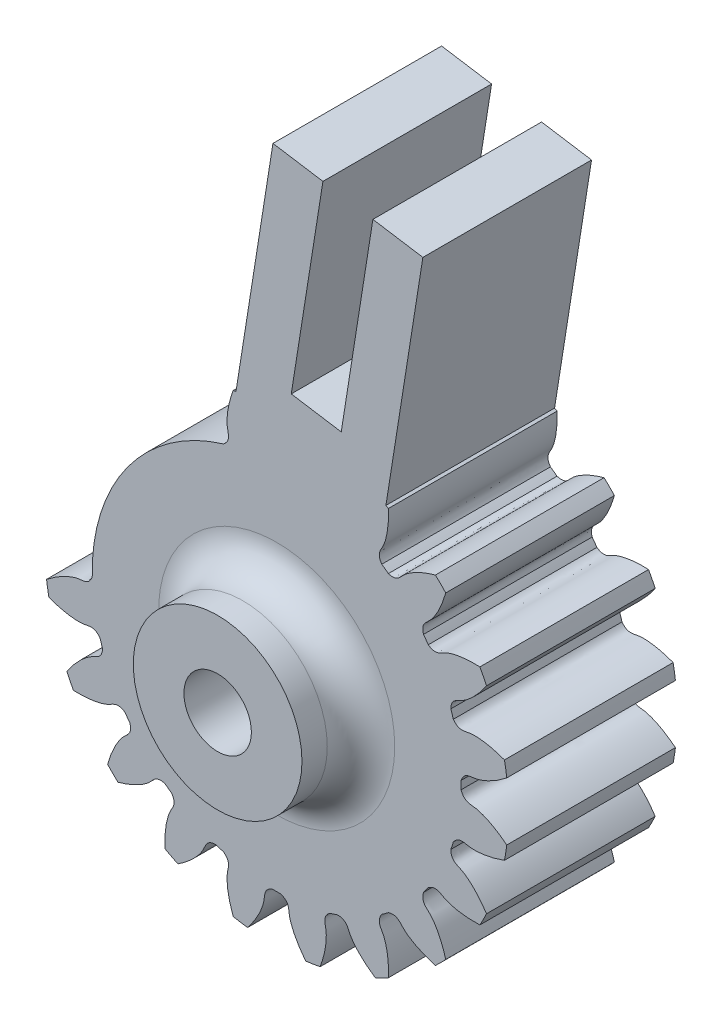
from build123d import *

# Parameters (mm, degrees)
SKETCH_1_R               = 13.75
EXTRUDE_1_DEPTH          = 10
CUT_EXTRUDE_1_DEPTH      = 22.866069606
PATTERN_CIRCULAR_1_COUNT = 20
EXTRUDE_2_DEPTH          = 5
EXTRUDE_2_DEPTH_BACK     = 15
CUT_EXTRUDE_3_DEPTH      = 10
CUT_EXTRUDE_3_DEPTH_BACK = 32
SKETCH_7_W               = 5
SKETCH_7_H               = 32
CUT_EXTRUDE_START        = -22
CUT_EXTRUDE_4_DEPTH      = 22
FILLET_2_R               = 2
FILLET_3_R               = 3
SKETCH_16_R              = 2
CUT_EXTRUDE_5_DEPTH      = 16.5
EXTRUDE_START            = 3.5
SKETCH_18_R              = 5
SKETCH_18_R_2            = 2
EXTRUDE_4_DEPTH          = 3.5
SKETCH_19_R              = 8
CUT_EXTRUDE_7_DEPTH      = 3
FILLET_4_R               = 2
CUT_EXTRUDE_8_DEPTH      = 10
CUT_EXTRUDE_9_DEPTH      = 36
CUT_EXTRUDE_9_DEPTH_BACK = 22


with BuildPart() as part:
    # 草图1 → 凸台-拉伸1 (new body)
    with BuildSketch(Plane.XY):
        Circle(SKETCH_1_R)
    extrude(amount=EXTRUDE_1_DEPTH)

    # 草图2 → 切除-拉伸1 (cut, through all)
    with BuildSketch(Plane.XY):
        with BuildLine():
            ThreePointArc((0.241645751, 10.934830295), (0, 10.9375), (-0.241645751, 10.934830295))
            add(Edge.make_bspline(
                [(-0.241645751, 10.934830295), (-0.763986756, 11.11684439), (-0.696355124, 11.483892124), (-0.766121321, 11.837511753), (-0.773615233, 11.871945767), (-0.782888612, 11.910793269), (-0.794115121, 11.953996045), (-0.807473925, 12.001489371), (-0.823140069, 12.053203535), (-0.841287339, 12.109063416), (-0.862087187, 12.168988684), (-0.885708875, 12.232893806), (-0.912319248, 12.300688126), (-0.942082628, 12.372275913), (-0.975160664, 12.447556439), (-1.011712206, 12.526424039), (-1.051893167, 12.608768189), (-1.095856396, 12.694473577), (-1.143751548, 12.783420187), (-1.195724957, 12.87548338), (-1.251919512, 12.970533976), (-1.312474533, 13.068438347), (-1.377525652, 13.169058507), (-1.447204695, 13.272252205), (-1.521639564, 13.377873025), (-1.600954126, 13.485770488), (-1.685268101, 13.595790151), (-1.774696952, 13.707773716), (-1.869351783, 13.821559139), (-1.969339231, 13.936980743), (-2.074761371, 14.053869328), (-2.185715611, 14.172052294), (-2.302294605, 14.291353753), (-2.424586158, 14.411594659), (-2.552673133, 14.532592924), (-2.686633373, 14.654163553), (-2.826539612, 14.776118764), (-2.972459398, 14.898268124), (-3.124455015, 15.020418683), (-3.282583418, 15.142375102), (-3.446896124, 15.2639398), (-3.676841988, 15.427049835), (-3.854915516, 15.545415751), (-3.976447477, 15.622814825)],
                knots=[0, 0, 0, 0, 0.165916003, 0.170905922, 0.176663519, 0.183188797, 0.190481754, 0.198542391, 0.207370708, 0.216966704, 0.22733038, 0.238461736, 0.250360771, 0.263027487, 0.276461881, 0.290663956, 0.30563371, 0.321371144, 0.337876258, 0.355149051, 0.373189524, 0.391997677, 0.411573509, 0.431917021, 0.453028213, 0.474907084, 0.497553636, 0.520967867, 0.545149777, 0.570099367, 0.595816637, 0.622301587, 0.649554216, 0.677574526, 0.706362514, 0.735918183, 0.766241531, 0.797332559, 0.829191267, 0.861817654, 0.895211721, 0.929373468, 1, 1, 1, 1], degree=3))
            ThreePointArc((-3.976447477, 15.622814825), (0, 16.120932901), (3.976447477, 15.622814825))
            add(Edge.make_bspline(
                [(0.241645751, 10.934830295), (0.763986756, 11.11684439), (0.696355124, 11.483892124), (0.766121321, 11.837511753), (0.773615233, 11.871945767), (0.782888612, 11.910793269), (0.794115121, 11.953996045), (0.807473925, 12.001489371), (0.823140069, 12.053203535), (0.841287339, 12.109063416), (0.862087187, 12.168988684), (0.885708875, 12.232893806), (0.912319248, 12.300688126), (0.942082628, 12.372275913), (0.975160664, 12.447556439), (1.011712206, 12.526424039), (1.051893167, 12.608768189), (1.095856396, 12.694473577), (1.143751548, 12.783420187), (1.195724957, 12.87548338), (1.251919512, 12.970533976), (1.312474533, 13.068438347), (1.377525652, 13.169058507), (1.447204695, 13.272252205), (1.521639564, 13.377873025), (1.600954126, 13.485770488), (1.685268101, 13.595790151), (1.774696952, 13.707773716), (1.869351783, 13.821559139), (1.969339231, 13.936980743), (2.074761371, 14.053869328), (2.185715611, 14.172052294), (2.302294605, 14.291353753), (2.424586158, 14.411594659), (2.552673133, 14.532592924), (2.686633373, 14.654163553), (2.826539612, 14.776118764), (2.972459398, 14.898268124), (3.124455015, 15.020418683), (3.282583418, 15.142375102), (3.446896124, 15.2639398), (3.676841988, 15.427049835), (3.854915516, 15.545415751), (3.976447477, 15.622814825)],
                knots=[0, 0, 0, 0, 0.165916003, 0.170905922, 0.176663519, 0.183188797, 0.190481754, 0.198542391, 0.207370708, 0.216966704, 0.22733038, 0.238461736, 0.250360771, 0.263027487, 0.276461881, 0.290663956, 0.30563371, 0.321371144, 0.337876258, 0.355149051, 0.373189524, 0.391997677, 0.411573509, 0.431917021, 0.453028213, 0.474907084, 0.497553636, 0.520967867, 0.545149777, 0.570099367, 0.595816637, 0.622301587, 0.649554216, 0.677574526, 0.706362514, 0.735918183, 0.766241531, 0.797332559, 0.829191267, 0.861817654, 0.895211721, 0.929373468, 1, 1, 1, 1], degree=3))
        make_face()
    cut_extrude_1 = extrude(amount=CUT_EXTRUDE_1_DEPTH, mode=Mode.SUBTRACT)

    # 阵列(圆周)1: 切除-拉伸1 ×20 about axis
    pattern_circular_1_axis = Axis((0, 0, -1.5), (0, 0, 1))
    for i in range(1, PATTERN_CIRCULAR_1_COUNT):
        add(cut_extrude_1.rotate(pattern_circular_1_axis, i * 360 / PATTERN_CIRCULAR_1_COUNT), mode=Mode.SUBTRACT)

    # 草图6 → 凸台-拉伸2 (add, two sides: drawn at the far end of the back side and taken through both)
    with BuildSketch(Plane(origin=(0, 0, 0), x_dir=(-1, 0, 0), z_dir=(0, 0, -1)).offset(-EXTRUDE_2_DEPTH_BACK)):
        with BuildLine():
            Line((-4.444597533, -0.703955093), (4.444597533, 0.703955093))
            Line((4.444597533, 0.703955093), (-1.123309149, 35.858334335))
            ThreePointArc((-1.123309149, 35.858334335), (6.18175463, 61.653569146), (-11.311209389, 81.969924763))
            Line((-11.311209389, 81.969924763), (-15.719831619, 70.4850712))
            Line((-15.719831619, 70.4850712), (-10.012504214, 34.45042415))
            Line((-10.012504214, 34.45042415), (-4.444597533, -0.703955093))
        make_face()
    extrude(amount=EXTRUDE_2_DEPTH + EXTRUDE_2_DEPTH_BACK)

    # 草图7 → 切除-拉伸3 (cut, two sides: drawn at the far end of the back side and taken through both)
    with BuildSketch(Plane(origin=(4.444597533, -0.703955093, 0), x_dir=(0, 0, -1), z_dir=(0.9876883405951377, -0.15643446504023123, 0)).offset(-CUT_EXTRUDE_3_DEPTH_BACK)):
        with Locations((2.5, 16)):
            Rectangle(SKETCH_7_W, SKETCH_7_H)
        with Locations((-12.5, 16)):
            Rectangle(SKETCH_7_W, SKETCH_7_H)
    extrude(amount=CUT_EXTRUDE_3_DEPTH + CUT_EXTRUDE_3_DEPTH_BACK, mode=Mode.SUBTRACT)

    # 草图13 → 切除-旋转2 (revolve, cut)
    with BuildSketch(Plane(origin=(12.346104257, -1.955430813, 0), x_dir=(0, 0, 1), z_dir=(-0.9876883405951388, 0.1564344650402244, 0))):
        with BuildLine():
            Line((5, 82.653118449), (5, 34.653118449))
            ThreePointArc((5, 34.653118449), (29, 58.653118449), (5, 82.653118449))
        make_face()
    revolve(axis=Axis((12.41385891, -1.527644771, 5), (0.1564344650402244, 0.9876883405951388, 0)), mode=Mode.SUBTRACT)

    # 草图12 → 切除-拉伸4 (cut)
    with BuildSketch(Plane(origin=(0, 0, -5), x_dir=(-1, 0, 0), z_dir=(0, 0, -1)).offset(CUT_EXTRUDE_START)):
        with BuildLine():
            Line((-11.311209389, 81.969924763), (-11.670273789, 81.03453002))
            ThreePointArc((-11.670273789, 81.03453002), (1.044926137, 71.010674644), (5.846281188, 55.547784376))
            ThreePointArc((5.846281188, 55.547784376), (3.991334875, 45.656412233), (-1.321428913, 37.109213298))
            Line((-1.321428913, 37.109213298), (-1.123309149, 35.858334335))
            ThreePointArc((-1.123309149, 35.858334335), (4.779753161, 44.926816989), (6.848224584, 55.547784376))
            ThreePointArc((6.848224584, 55.547784376), (1.87065393, 71.578181633), (-11.311209389, 81.969924763))
        make_face()
    extrude(amount=CUT_EXTRUDE_4_DEPTH, mode=Mode.SUBTRACT)

    # 圆角2
    fillet_2_edges = [part.edges().sort_by_distance(p)[0] for p in [
        (5.005902881, 31.606026899, 10),
        (5.005902881, 31.606026899, 15),
        (5.005902881, 31.606026899, 0),
        (5.005902881, 31.606026899, -5),
    ]]
    fillet(fillet_2_edges, radius=FILLET_2_R)

    # 圆角3
    fillet_3_edges = [part.edges().sort_by_distance(p)[0] for p in [
        (-5.118751176, 61.808282659, 15),
        (-5.118751176, 61.808282659, -5),
    ]]
    fillet(fillet_3_edges, radius=FILLET_3_R)

    # 草图16 → 切除-拉伸5 (cut)
    with BuildSketch(Plane.XY.offset(10)):
        Circle(SKETCH_16_R)
    extrude(amount=-CUT_EXTRUDE_5_DEPTH, mode=Mode.SUBTRACT)

    # 草图18 → 凸台-拉伸4 (add)
    with BuildSketch(Plane.XY.offset(10).offset(EXTRUDE_START)):
        Circle(SKETCH_18_R)
        Circle(SKETCH_18_R_2, mode=Mode.SUBTRACT)
    extrude(amount=-EXTRUDE_4_DEPTH)

    # 草图19 → 切除-拉伸7 (cut)
    with BuildSketch(Plane(origin=(0, 0, 0), x_dir=(-1, 0, 0), z_dir=(0, 0, -1))):
        Circle(SKETCH_19_R)
    extrude(amount=-CUT_EXTRUDE_7_DEPTH, mode=Mode.SUBTRACT)

    # 圆角4
    fillet_4_edges = [part.edges().sort_by_distance(p)[0] for p in [
        (-5, 0, 10),
    ]]
    fillet(fillet_4_edges, radius=FILLET_4_R)

    # 草图20 → 切除-拉伸8 (cut)
    with BuildSketch(Plane(origin=(0, 0, 0), x_dir=(-1, 0, 0), z_dir=(0, 0, -1))):
        with BuildLine():
            Line((5.774187452, 16.519950341), (3.608867158, 10.324968963))
            ThreePointArc((3.608867158, 10.324968963), (8.919105639, 6.330755157), (10.9375, 0))
            ThreePointArc((10.9375, 0), (10.936832553, -0.120830249), (10.934830295, -0.241645751))
            Line((10.934830295, -0.241645751), (17.498331559, -0.241645751))
            ThreePointArc((17.498331559, -0.241645751), (17.499582885, -0.120825755), (17.5, 0))
            ThreePointArc((17.5, 0), (14.270569022, 10.129208251), (5.774187452, 16.519950341))
        make_face()
    extrude(amount=-CUT_EXTRUDE_8_DEPTH, mode=Mode.SUBTRACT)

    # 草图21 → 切除-拉伸9 (cut, two sides: drawn at the far end of the back side and taken through both)
    with BuildSketch(Plane(origin=(0, 0, 0), x_dir=(-1, 0, 0), z_dir=(0, 0, -1)).offset(-CUT_EXTRUDE_9_DEPTH_BACK)):
        Polygon((-3.828049486, 14.580673411), (-0.864984465, 15.049976806), (-2.742198045, 26.902236894), (17.011568767, 30.030926194), (7.802056019, 88.177501256), (-13.453893683, 84.810889559), (-34.668542627, 81.450819259), (-25.459029879, 23.304244198), (-5.705263067, 26.432933499), align=None)
    extrude(amount=CUT_EXTRUDE_9_DEPTH + CUT_EXTRUDE_9_DEPTH_BACK, mode=Mode.SUBTRACT)


solid = part.part
